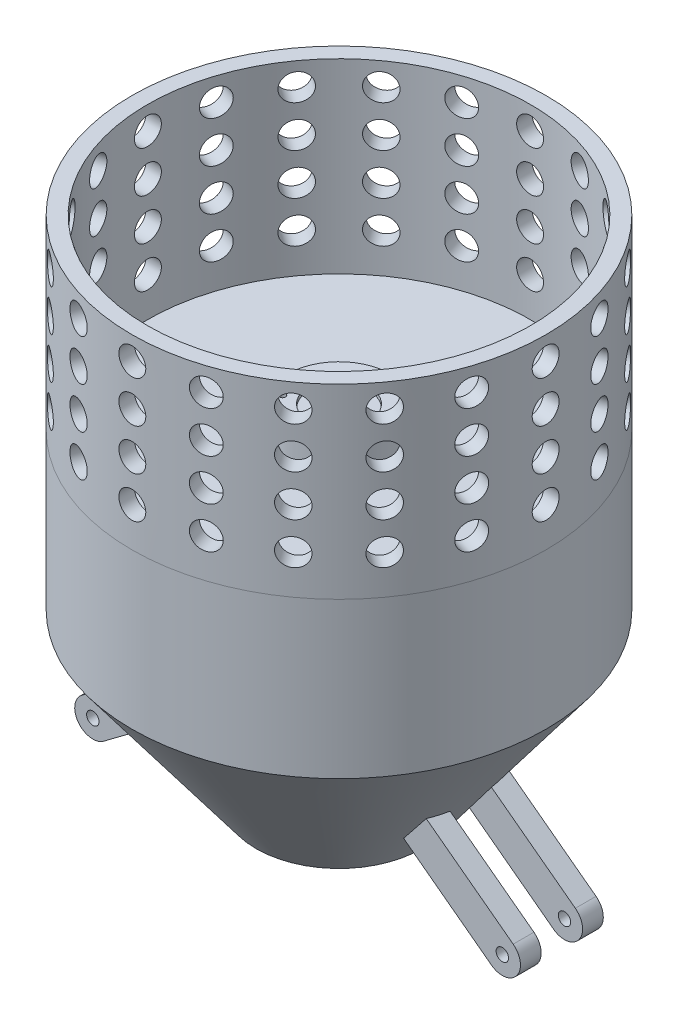
from build123d import *

# Parameters (mm, degrees)
SKETCH3_R             = 12.5
SKETCH4_R             = 12.5
SKETCH5_R             = 50
BOSS_EXTRUDE1_DEPTH   = 22
SKETCH9_W             = 20
SKETCH9_H             = 59.785050732
BOSS_EXTRUDE2_START   = 10
SKETCH10_R            = 20
SKETCH10_R_2          = 8
BOSS_EXTRUDE2_DEPTH   = 10
SKETCH13_R            = 17.5
CUT_EXTRUDE2_DEPTH    = 136
SKETCH14_R            = 29
CUT_EXTRUDE3_DEPTH    = 3.5
SKETCH15_R            = 2.5
CUT_EXTRUDE4_DEPTH    = 3.5
SKETCH16_R            = 3
CUT_EXTRUDE5_DEPTH    = 11.5
SKETCH17_R            = 200
SKETCH17_R_2          = 185
BOSS_EXTRUDE3_DEPTH   = 180
SKETCH18_R            = 12.981172425
CUT_EXTRUDE6_DEPTH    = 381.667849092
CIRPATTERN5_COUNT     = 20
SKETCH19_R            = 6
BOSS_EXTRUDE4_DEPTH   = 10
BOSS_EXTRUDE4_2_DEPTH = 10
BOSS_EXTRUDE5_REACH   = 571.733
SKETCH20_W            = 20
SKETCH20_H            = 35
SKETCH21_R            = 6
BOSS_EXTRUDE6_DEPTH   = 10
BOSS_EXTRUDE6_2_DEPTH = 10
BOSS_EXTRUDE7_REACH   = 582.363
SKETCH23_W            = 20
SKETCH23_H            = 35
SKETCH24_W            = 20
SKETCH24_H            = 35
BOSS_EXTRUDE8_DEPTH   = 20
BOSS_EXTRUDE9_REACH   = 571.733
SKETCH25_W            = 20
SKETCH25_H            = 35


with BuildPart() as part:
    # Sketch2 → Revolve1 (revolve)
    with BuildSketch(Plane.XY, mode=Mode.PRIVATE) as revolve1_sk:
        Polygon((0, 55.229492814), (-200, 55.229492814), (-200, -94.770507186), (-80, -254.770507186), (-60, -254.770507186), (-180, -94.770507186), (-180, 35.229492814), (-97.5, 35.229492814), (-97.5, -104.770507186), (-35, -176.149581219), (0, -176.149581219), (0, 25.229492814), align=None)
    revolve(revolve1_sk.sketch.rotate(Axis((0, 57.349299688, 0), (0, -1, 0)), 270), axis=Axis((0, 57.349299688, 0), (0, -1, 0)))

    # Sketch3 → Cut-Revolve1 (revolve, cut)
    with BuildSketch(Plane.XY, mode=Mode.PRIVATE) as cut_revolve1_sk:
        with Locations((-107.86084091, 4.25029405)):
            Circle(SKETCH3_R)
        with Locations((-107.86084091, -9.735838459)):
            Circle(SKETCH3_R)
        with Locations((-107.86084091, -23.721970968)):
            Circle(SKETCH3_R)
        with Locations((-107.86084091, -37.708103477)):
            Circle(SKETCH3_R)
        with Locations((-107.86084091, -51.694235986)):
            Circle(SKETCH3_R)
        with Locations((-107.86084091, -65.680368495)):
            Circle(SKETCH3_R)
        with Locations((-107.86084091, -79.666501004)):
            Circle(SKETCH3_R)
        with Locations((-107.86084091, -93.652633513)):
            Circle(SKETCH3_R)
    revolve(cut_revolve1_sk.sketch.rotate(Axis((0, 80.728496273, 0), (0, -1, 0)), 270), axis=Axis((0, 80.728496273, 0), (0, -1, 0)), mode=Mode.SUBTRACT)

    # Sketch4 → Cut-Revolve2 (revolve, cut)
    with BuildSketch(Plane.XY, mode=Mode.PRIVATE) as cut_revolve2_sk:
        with Locations((-89.441475281, -133.126338415)):
            Circle(SKETCH4_R)
        with Locations((-99.446691515, -117.117992442)):
            Circle(SKETCH4_R)
        with Locations((-79.436259048, -149.134684389)):
            Circle(SKETCH4_R)
        with Locations((-69.431042815, -165.143030362)):
            Circle(SKETCH4_R)
        with Locations((-59.425826582, -181.151376335)):
            Circle(SKETCH4_R)
        with Locations((-49.420610349, -197.159722308)):
            Circle(SKETCH4_R)
    revolve(cut_revolve2_sk.sketch.rotate(Axis((0, 86.064622477, 0), (0, -1, 0)), 270), axis=Axis((0, 86.064622477, 0), (0, -1, 0)), mode=Mode.SUBTRACT)

    # Sketch5 → Boss-Extrude1 (add)
    with BuildSketch(Plane(origin=(0, 55.229492814, 0), x_dir=(1, 0, 0), z_dir=(0, 1, 0))):
        with Locations(Location((0, 0, 0), (0, 0, 270))):
            Circle(SKETCH5_R)
        with BuildLine():
            Line((-5.522648203, 5.787949277), (5.05222187, 6.202826306))
            ThreePointArc((5.05222187, 6.202826306), (7.993850388, 0.313617555), (5.522648203, -5.787949277))
            Line((5.522648203, -5.787949277), (-5.05222187, -6.202826306))
            ThreePointArc((-5.05222187, -6.202826306), (-7.993850388, -0.313617555), (-5.522648203, 5.787949277))
        make_face(mode=Mode.SUBTRACT)
    extrude(amount=BOSS_EXTRUDE1_DEPTH)

    # Sketch8 → Cut-Revolve3 (revolve, cut)
    with BuildSketch(Plane.XY):
        Polygon((0, 35.229492814), (-139.632590989, 35.229492814), (-139.632590989, -94.770507186), (-77.993020222, -221.307201222), (0, -221.307201222), align=None)
    revolve(axis=Axis((0, 134.665224064, 0), (0, -1, 0)), mode=Mode.SUBTRACT)

    # Sketch9 → Cut-Revolve4 (revolve, cut)
    with BuildSketch(Plane.XY, mode=Mode.PRIVATE) as cut_revolve4_sk:
        with Locations((10, 25.336967448)):
            Rectangle(SKETCH9_W, SKETCH9_H)
    revolve(cut_revolve4_sk.sketch.rotate(Axis((0, 118.493520201, 0), (0, -1, 0)), 90), axis=Axis((0, 118.493520201, 0), (0, -1, 0)), mode=Mode.SUBTRACT)

    # Sketch10 → Boss-Extrude2 (add)
    with BuildSketch(Plane.XZ.offset(-55.229492814).offset(BOSS_EXTRUDE2_START)):
        with Locations(Location((0, 0, 0), (0, 0, 270))):
            Circle(SKETCH10_R)
        with Locations(Location((0, 0, 0), (0, 0, 270))):
            Circle(SKETCH10_R_2, mode=Mode.SUBTRACT)
    extrude(amount=-BOSS_EXTRUDE2_DEPTH)

    # Sketch13 → Cut-Extrude2 (cut)
    with BuildSketch(Plane(origin=(0, 77.229492814, 0), x_dir=(1, 0, 0), z_dir=(0, 1, 0))):
        with Locations(Location((0, 0, 0), (0, 0, 270))):
            Circle(SKETCH13_R)
    extrude(amount=-CUT_EXTRUDE2_DEPTH, mode=Mode.SUBTRACT)

    # Sketch14 → Cut-Extrude3 (cut)
    with BuildSketch(Plane(origin=(0, 77.229492814, 0), x_dir=(1, 0, 0), z_dir=(0, 1, 0))):
        with Locations(Location((0, 0, 0), (0, 0, 270))):
            Circle(SKETCH14_R)
    extrude(amount=-CUT_EXTRUDE3_DEPTH, mode=Mode.SUBTRACT)

    # Sketch15 → Cut-Extrude4 (cut)
    with BuildSketch(Plane(origin=(0, 73.729492814, 0), x_dir=(1, 0, 0), z_dir=(0, 1, 0))):
        with Locations(Location((0, 40, 0), (0, 0, 270))):
            Circle(SKETCH15_R)
    extrude(amount=-CUT_EXTRUDE4_DEPTH, mode=Mode.SUBTRACT)

    # Sketch16 → Cut-Extrude5 (cut)
    with BuildSketch(Plane(origin=(0, 77.229492814, 0), x_dir=(1, 0, 0), z_dir=(0, 1, 0))):
        with Locations(Location((0, 40, 0), (0, 0, 270))):
            Circle(SKETCH16_R)
        with Locations(Location((34.641016151, -20, 0), (0, 0, 270))):
            Circle(SKETCH16_R)
        with Locations(Location((-34.641016151, -20, 0), (0, 0, 270))):
            Circle(SKETCH16_R)
    extrude(amount=-CUT_EXTRUDE5_DEPTH, mode=Mode.SUBTRACT)



with BuildPart() as body_2:
    # Sketch17 → Boss-Extrude3 (new body)
    with BuildSketch(Plane(origin=(0, 55.229492814, 0), x_dir=(1, 0, 0), z_dir=(0, 1, 0))):
        with Locations(Location((0, 0, 0), (0, 0, 90))):
            Circle(SKETCH17_R)
        with Locations(Location((0, 0, 0), (0, 0, 90))):
            Circle(SKETCH17_R_2, mode=Mode.SUBTRACT)
    extrude(amount=BOSS_EXTRUDE3_DEPTH)

    # Sketch18 → Cut-Extrude6 (cut, through all)
    with BuildSketch(Plane.XY):
        with Locations(Location((0, 213.002579199, 0), (0, 0, 90))):
            Circle(SKETCH18_R)
        with Locations(Location((0, 173.002579199, 0), (0, 0, 90))):
            Circle(SKETCH18_R)
        with Locations(Location((0, 133.002579199, 0), (0, 0, 90))):
            Circle(SKETCH18_R)
        with Locations(Location((0, 93.002579199, 0), (0, 0, 90))):
            Circle(SKETCH18_R)
    cut_extrude6 = extrude(amount=-CUT_EXTRUDE6_DEPTH, mode=Mode.SUBTRACT)

    # CirPattern5: Cut-Extrude6 ×20 about axis
    cirpattern5_axis = Axis((0, 235.229492814, 0), (0, -1, 0))
    for i in range(1, CIRPATTERN5_COUNT):
        add(cut_extrude6.rotate(cirpattern5_axis, i * 360 / CIRPATTERN5_COUNT), mode=Mode.SUBTRACT)


with BuildPart() as body_3:
    # Sketch19 → Boss-Extrude4 (new, symmetric)
    with BuildSketch(Plane.XY.offset(30)):
        with BuildLine():
            Line((-128.247595605, -190.440379712), (-208.247595605, -250.440379712))
            ThreePointArc((-208.247595605, -250.440379712), (-211.747595605, -274.940379712), (-187.247595605, -278.440379712))
            Line((-187.247595605, -278.440379712), (-107.247595605, -218.440379712))
            Line((-107.247595605, -218.440379712), (-128.247595605, -190.440379712))
        make_face()
        with Locations((-197.747595605, -264.440379712)):
            Circle(SKETCH19_R, mode=Mode.SUBTRACT)
    extrude(amount=BOSS_EXTRUDE4_DEPTH, both=True)


with BuildPart() as body_4:
    # Sketch19 → Boss-Extrude4 2 (new, symmetric)
    with BuildSketch(Plane.XY.offset(30)):
        with BuildLine():
            ThreePointArc((208.247595605, -250.440379712), (211.747595605, -274.940379712), (187.247595605, -278.440379712))
            Line((187.247595605, -278.440379712), (107.247595605, -218.440379712))
            Line((107.247595605, -218.440379712), (128.247595605, -190.440379712))
            Line((128.247595605, -190.440379712), (208.247595605, -250.440379712))
        make_face()
        with Locations((197.747595605, -264.440379712)):
            Circle(SKETCH19_R, mode=Mode.SUBTRACT)
    extrude(amount=BOSS_EXTRUDE4_2_DEPTH, both=True)


with BuildPart() as part_1:
    add(part.part)

    add(body_3.part)  # Boss-Extrude5 merges body 3
    # Boss-Extrude5: up to this cone (the profile starts outside it)
    boss_extrude5_end = Plane(origin=(0, -204.44038, 0), z_dir=(0, 1, 0)).offset(-156.996792853) * Cone(1e-06, 635.233041932, 846.977388243, align=(Align.CENTER, Align.CENTER, Align.MIN), mode=Mode.PRIVATE)
    # Sketch20 → Boss-Extrude5 (add, up to the surface)
    with BuildSketch(Plane(origin=(-173.489843449, -130.117382587, 0), x_dir=(0, 0, -1), z_dir=(0.8, 0.6000000000000001, 0)), mode=Mode.PRIVATE) as boss_extrude5_sk1:
        with Locations((-30, -92.903746407)):
            Rectangle(SKETCH20_W, SKETCH20_H)
    boss_extrude5_tool1 = extrude(boss_extrude5_sk1.sketch, amount=BOSS_EXTRUDE5_REACH, mode=Mode.PRIVATE) - boss_extrude5_end
    add(boss_extrude5_tool1.solids().sort_by_distance((-117.747596, -204.44038, 30))[0])



with BuildPart() as body_4_2:
    # Sketch21 → Boss-Extrude6 (new, symmetric)
    with BuildSketch(Plane.XY.offset(-30)):
        with BuildLine():
            Line((-137.372813461, -197.284293104), (-116.372813461, -225.284293104))
            Line((-116.372813461, -225.284293104), (-187.247595605, -278.440379712))
            ThreePointArc((-187.247595605, -278.440379712), (-211.747595605, -274.940379712), (-208.247595605, -250.440379712))
            Line((-208.247595605, -250.440379712), (-137.372813461, -197.284293104))
        make_face()
        with Locations((-197.747595605, -264.440379712)):
            Circle(SKETCH21_R, mode=Mode.SUBTRACT)
    extrude(amount=BOSS_EXTRUDE6_DEPTH, both=True)


with BuildPart() as body_5:
    # Sketch21 → Boss-Extrude6 2 (new, symmetric)
    with BuildSketch(Plane.XY.offset(-30)):
        with BuildLine():
            Line((187.247595605, -278.440379712), (116.372813461, -225.284293104))
            Line((116.372813461, -225.284293104), (137.372813461, -197.284293104))
            Line((137.372813461, -197.284293104), (208.247595605, -250.440379712))
            ThreePointArc((208.247595605, -250.440379712), (211.747595605, -274.940379712), (187.247595605, -278.440379712))
        make_face()
        with Locations((197.747595605, -264.440379712)):
            Circle(SKETCH21_R, mode=Mode.SUBTRACT)
    extrude(amount=BOSS_EXTRUDE6_2_DEPTH, both=True)


with BuildPart() as part_2:
    add(part_1.part)

    add(body_4_2.part)  # Boss-Extrude7 merges body 4 2
    # Boss-Extrude7: up to this cone (the profile starts outside it)
    boss_extrude7_end = Plane(origin=(0, -211.284293, 0), z_dir=(0, 1, 0)).offset(-150.152879853) * Cone(1e-06, 634.22290612, 845.630540493, align=(Align.CENTER, Align.CENTER, Align.MIN), mode=Mode.PRIVATE)
    # Sketch23 → Boss-Extrude7 (add, up to the surface)
    with BuildSketch(Plane(origin=(-182.615061305, -136.961295979, 0), x_dir=(0, 0, -1), z_dir=(0.8, 0.6, 0)), mode=Mode.PRIVATE) as boss_extrude7_sk1:
        with Locations((30, -92.903746407)):
            Rectangle(SKETCH23_W, SKETCH23_H)
    boss_extrude7_tool1 = extrude(boss_extrude7_sk1.sketch, amount=BOSS_EXTRUDE7_REACH, mode=Mode.PRIVATE) - boss_extrude7_end
    add(boss_extrude7_tool1.solids().sort_by_distance((-126.872813, -211.284293, -30))[0])


    add(body_5.part)  # Boss-Extrude8 merges body 5
    # Sketch24 → Boss-Extrude8 (add)
    with BuildSketch(Plane(origin=(182.615061305, -136.961295979, 0), x_dir=(0, 0, 1), z_dir=(-0.8, 0.6, 0))):
        with Locations((-30, -92.903746407)):
            Rectangle(SKETCH24_W, SKETCH24_H)
    extrude(amount=BOSS_EXTRUDE8_DEPTH)


    add(body_4.part)  # Boss-Extrude9 merges body 4
    # Boss-Extrude9: up to this cone (the profile starts outside it)
    boss_extrude9_end = Plane(origin=(0, -204.44038, 0), z_dir=(0, 1, 0)).offset(-156.996792853) * Cone(1e-06, 635.233041932, 846.977388243, align=(Align.CENTER, Align.CENTER, Align.MIN), mode=Mode.PRIVATE)
    # Sketch25 → Boss-Extrude9 (add, up to the surface)
    with BuildSketch(Plane(origin=(173.489843449, -130.117382587, 0), x_dir=(0, 0, 1), z_dir=(-0.8, 0.6000000000000001, 0)), mode=Mode.PRIVATE) as boss_extrude9_sk1:
        with Locations((30, -92.903746407)):
            Rectangle(SKETCH25_W, SKETCH25_H)
    boss_extrude9_tool1 = extrude(boss_extrude9_sk1.sketch, amount=BOSS_EXTRUDE9_REACH, mode=Mode.PRIVATE) - boss_extrude9_end
    add(boss_extrude9_tool1.solids().sort_by_distance((117.747596, -204.44038, 30))[0])


solid = Compound([body_2.part, part_2.part])
